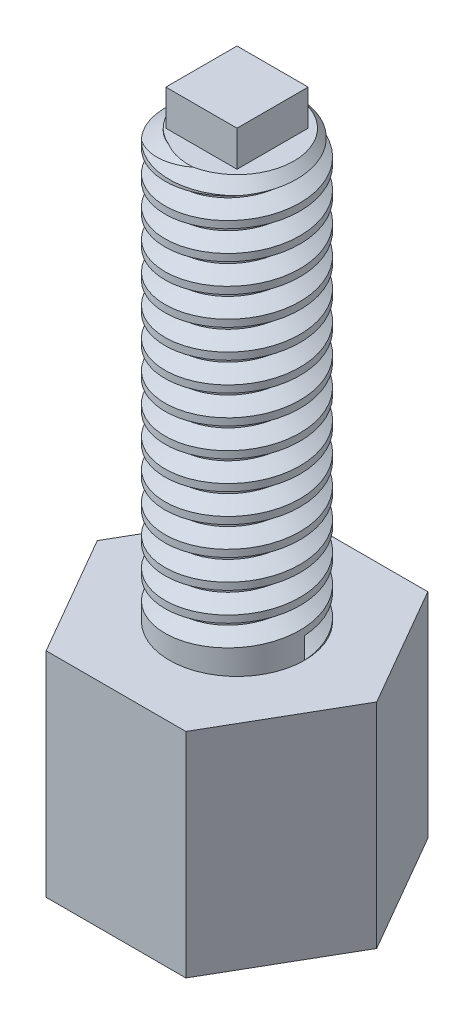
from build123d import *
from build123d.topology import SkipClean

# Parameters (mm, degrees)
BOSS_EXTRUDE1_DEPTH = 15
SKETCH2_R           = 9.5
BOSS_EXTRUDE2_DEPTH = 60
CHAMFER1_SIZE       = 1.5
THREAD3_PITCH       = 4
SKETCH19_W          = 10
SKETCH19_H          = 10
BOSS_EXTRUDE4_DEPTH = 5


with BuildPart() as part:
    # Sketch1 → Boss-Extrude1 (new, symmetric)
    with BuildSketch(Plane(origin=(0, 0, 0), x_dir=(1, 0, 0), z_dir=(0, 1, 0))):
        Polygon((19.629909152, 0), (9.814954576, 17), (-9.814954576, 17), (-19.629909152, 0), (-9.814954576, -17), (9.814954576, -17), align=None)
    extrude(amount=BOSS_EXTRUDE1_DEPTH, both=True)

    # Sketch2 → Boss-Extrude2 (add)
    with BuildSketch(Plane(origin=(0, 15, 0), x_dir=(1, 0, 0), z_dir=(0, 1, 0))):
        with Locations(Location((0, 0, 0), (0, 0, 270))):
            Circle(SKETCH2_R)
    extrude(amount=BOSS_EXTRUDE2_DEPTH)

    # Chamfer1
    chamfer1_edges = [part.edges().sort_by_distance(p)[0] for p in [
        (0, 75, -9.5),
    ]]
    chamfer(chamfer1_edges, length=CHAMFER1_SIZE)

    # Thread3: the profile of Thread Profile3 profile screwed along a right-hand helix of 15 turns, 12 arcs to a turn; built about Z, then put on its axis
    with SkipClean():  # the faces are left unmerged after this step: merging them gives an invalid solid
        thread3_z = Axis((0, 0, 0), (0, 0, 1))
        thread3_corners = [(9.5003, 0, -0.000173205), (7.3349365, 0, 1.249999995), (7.3349365, 0, 1.749999995), (9.5003, 0, 3.000173194)]
        with BuildLine(mode=Mode.PRIVATE) as thread3_profile:
            Line(thread3_corners[0], thread3_corners[1])
            Line(thread3_corners[1], thread3_corners[2])
            Line(thread3_corners[2], thread3_corners[3])
            Line(thread3_corners[3], thread3_corners[0])
        thread3_cap = Face(thread3_profile.wire())
        thread3_turn_angles = [0, 15, 30, 45, 60, 75, 90, 105, 120, 135, 150, 165, 180, 195, 210, 225, 240, 255, 270, 285, 300, 315, 330, 345, 360]
        thread3_turn_weights = [1, 0.9659258262890683, 1, 0.9659258262890683, 1, 0.9659258262890683, 1, 0.9659258262890683, 1, 0.9659258262890683, 1, 0.9659258262890683, 1, 0.9659258262890683, 1, 0.9659258262890683, 1, 0.9659258262890683, 1, 0.9659258262890683, 1, 0.9659258262890683, 1, 0.9659258262890683, 1]
        thread3_turn_rails = [Edge.make_bspline([Vector(p[0], p[1], 0).rotate(thread3_z, thread3_turn_angles[k]) / thread3_turn_weights[k] + Vector(0, 0, p[2] + THREAD3_PITCH * thread3_turn_angles[k] / 360) for k in range(25)], [0, 0, 0, 1, 1, 2, 2, 3, 3, 4, 4, 5, 5, 6, 6, 7, 7, 8, 8, 9, 9, 10, 10, 11, 11, 12, 12, 12], 2, thread3_turn_weights) for p in thread3_corners]
        thread3_turn_sides = [Face.make_surface_from_curves(thread3_turn_rails[p[0]], thread3_turn_rails[p[1]]) for p in [(0, 1), (1, 2), (2, 3), (3, 0)]]
        thread3 = Plane(origin=(0, 15, 0), x_dir=(1, 0, 0), z_dir=(0, 1, 0)) * Solid(Shell([*[p.moved(Location((0, 0, THREAD3_PITCH * i))) for i in range(15) for p in thread3_turn_sides], thread3_cap, thread3_cap.rotate(thread3_z, 5400).moved(Location((0, 0, THREAD3_PITCH * 5400 / 360)))]))
        add(thread3, mode=Mode.SUBTRACT)

    # Sketch19 → Boss-Extrude4 (add)
    with SkipClean():  # the faces are left unmerged after this step: merging them gives an invalid solid
        with BuildSketch(Plane(origin=(0, 75, 0), x_dir=(1, 0, 0), z_dir=(0, 1, 0))):
            Rectangle(SKETCH19_W, SKETCH19_H)
        extrude(amount=BOSS_EXTRUDE4_DEPTH)


solid = part.part
